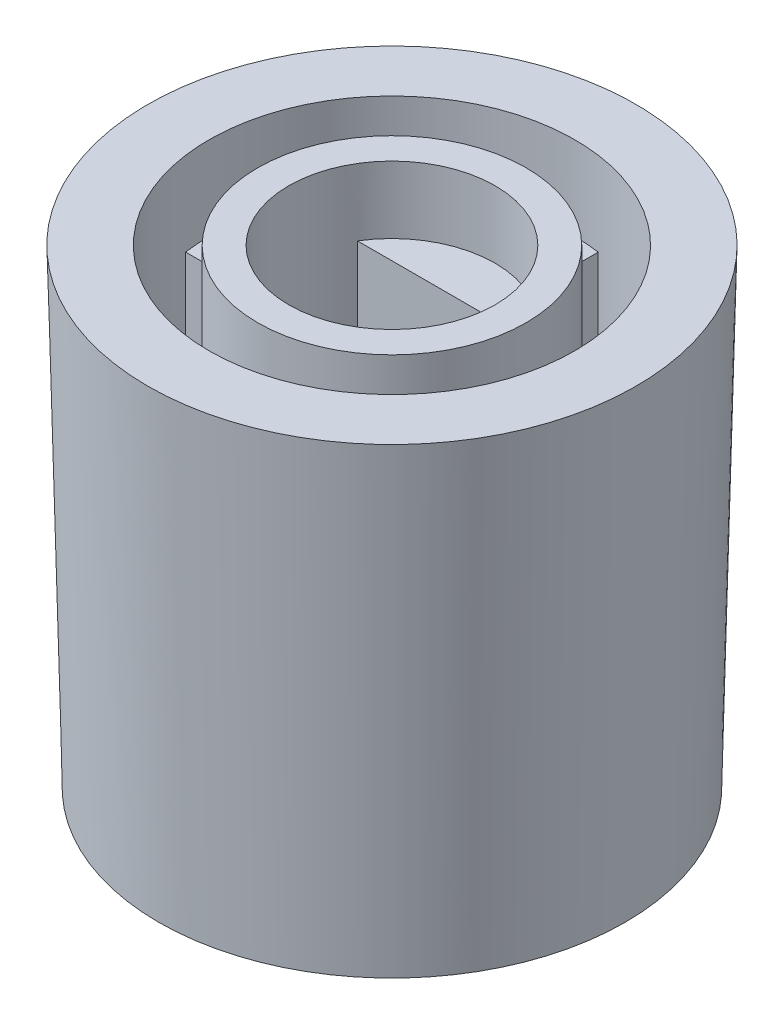
from build123d import *

# Parameters (mm, degrees)
SKETCH1_R           = 6.95
BOSS_EXTRUDE1_DEPTH = 3.5
SKETCH2_R           = 6.95
SKETCH2_R_2         = 5.45
BOSS_EXTRUDE2_DEPTH = 10.5
DRAFT1_ANGLE        = 1.325
SKETCH6_R           = 4
BOSS_EXTRUDE3_DEPTH = 10.5
CUT_EXTRUDE1_DEPTH  = 9
SKETCH7_R           = 3.075
CUT_EXTRUDE2_DEPTH  = 2
SKETCH8_W           = 2.525210291
SKETCH8_H           = 1.5
SKETCH8_W_2         = 2.122251202
SKETCH8_W_3         = 1.5
SKETCH8_H_2         = 2.337162717
SKETCH8_H_3         = 2.758031098
BOSS_EXTRUDE4_DEPTH = 8


with BuildPart() as part:
    # Sketch1 → Boss-Extrude1 (new body)
    with BuildSketch(Plane(origin=(0, 0, 0), x_dir=(1, 0, 0), z_dir=(0, 1, 0))):
        Circle(SKETCH1_R)
    extrude(amount=BOSS_EXTRUDE1_DEPTH)

    # Sketch2 → Boss-Extrude2 (add)
    with BuildSketch(Plane(origin=(0, 3.5, 0), x_dir=(1, 0, 0), z_dir=(0, 1, 0))):
        Circle(SKETCH2_R)
        Circle(SKETCH2_R_2, mode=Mode.SUBTRACT)
    extrude(amount=BOSS_EXTRUDE2_DEPTH)

    # Draft1
    draft1_faces = [part.faces().sort_by_distance(p)[0] for p in [
        (-6.95, 7, 0),
    ]]
    draft(draft1_faces, Plane(origin=(0, 0, 0), x_dir=(0, 0, -1), z_dir=(0, -1, 0)), DRAFT1_ANGLE)

    # Sketch6 → Boss-Extrude3 (add)
    with BuildSketch(Plane(origin=(0, 3.5, 0), x_dir=(1, 0, 0), z_dir=(0, 1, 0))):
        Circle(SKETCH6_R)
    extrude(amount=BOSS_EXTRUDE3_DEPTH)

    # Sketch5 → Cut-Extrude1 (cut)
    with BuildSketch(Plane(origin=(0, 14, 0), x_dir=(1, 0, 0), z_dir=(0, 1, 0))):
        with BuildLine():
            Line((2.625952208, 1.6), (-2.625952208, 1.6))
            ThreePointArc((-2.625952208, 1.6), (-0.83090973, -2.960610413), (3.075, 0))
            ThreePointArc((3.075, 0), (2.960610413, 0.83090973), (2.625952208, 1.6))
        make_face()
    extrude(amount=-CUT_EXTRUDE1_DEPTH, mode=Mode.SUBTRACT)

    # Sketch7 → Cut-Extrude2 (cut)
    with BuildSketch(Plane(origin=(0, 14, 0), x_dir=(1, 0, 0), z_dir=(0, 1, 0))):
        Circle(SKETCH7_R)
    extrude(amount=-CUT_EXTRUDE2_DEPTH, mode=Mode.SUBTRACT)

    # Sketch8 → Boss-Extrude4 (add)
    with BuildSketch(Plane(origin=(0, 3.5, 0), x_dir=(1, 0, 0), z_dir=(0, 1, 0))):
        with Locations((-4.853418362, 0)):
            Rectangle(SKETCH8_W, SKETCH8_H)
        with Locations((4.696712049, 0)):
            Rectangle(SKETCH8_W_2, SKETCH8_H)
        with Locations((0, 4.745962605)):
            Rectangle(SKETCH8_W_3, SKETCH8_H_2)
        with Locations((0, -4.822077099)):
            Rectangle(SKETCH8_W_3, SKETCH8_H_3)
    extrude(amount=BOSS_EXTRUDE4_DEPTH)


solid = part.part
